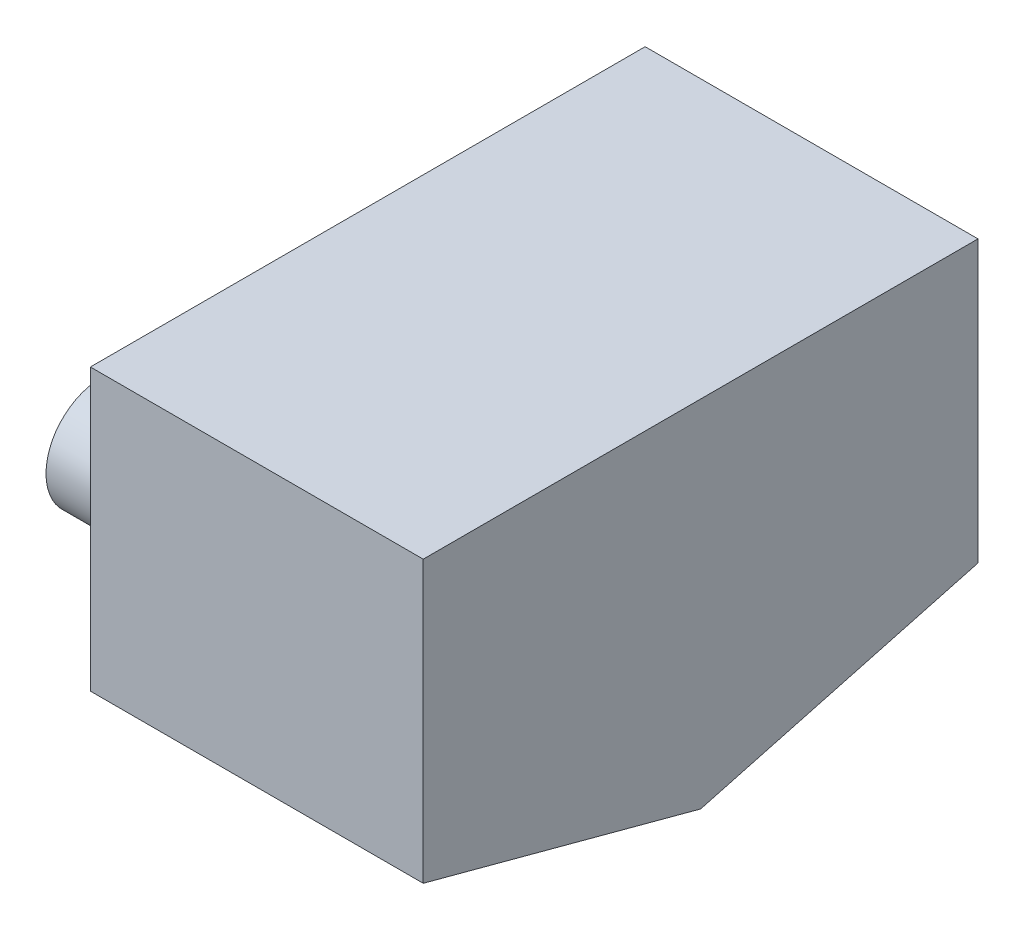
from build123d import *

# Parameters (mm, degrees)
SKETCH2_W           = 15
SKETCH2_H           = 16
BOSS_EXTRUDE2_DEPTH = 25
SKETCH3_R           = 2.5
BOSS_EXTRUDE3_DEPTH = 5
CHAMFER1_SIZE       = 12.5
CHAMFER1_SIZE2      = 3.349364905
CHAMFER2_SIZE       = 12.5
CHAMFER2_SIZE_2     = 3.349364905


with BuildPart() as part:
    # Sketch2 → Boss-Extrude2 (new body)
    with BuildSketch(Plane.XY):
        with Locations((7.5, 8)):
            Rectangle(SKETCH2_W, SKETCH2_H)
    extrude(amount=BOSS_EXTRUDE2_DEPTH)

    # Sketch3 → Boss-Extrude3 (add)
    with BuildSketch(Plane.ZY):
        with Locations(Location((5.5, 7.837863741, 0), (0, 0, 90))):
            Circle(SKETCH3_R)
        with Locations(Location((19.5, 7.837863741, 0), (0, 0, 90))):
            Circle(SKETCH3_R)
    extrude(amount=BOSS_EXTRUDE3_DEPTH)

    # Chamfer1
    chamfer1_edges = [part.edges().sort_by_distance(p)[0] for p in [
        (7.5, 0, 25),
    ]]
    chamfer1_side = [part.faces().sort_by_distance(p)[0] for p in [
        (7.5, 0, 12.5),
    ]]
    chamfer(chamfer1_edges, length=CHAMFER1_SIZE, length2=CHAMFER1_SIZE2, reference=chamfer1_side[0])

    # Chamfer2
    # the kernel refuses this chamfer: 12.5, 3.349364905 mm, written as the material it takes off along each edge
    with BuildSketch(Plane(origin=(-32.459019628, 0, 0), x_dir=(0, -0.009967146577156423, 0.9999503267608394), z_dir=(1, 0, 0))) as chamfer2_piece_1:
        Polygon((CHAMFER2_SIZE * 0.999950326761, -CHAMFER2_SIZE * 0.00996714657716), (-CHAMFER2_SIZE_2 * 0.00996714657831, -CHAMFER2_SIZE_2 * 0.999950326877), (0, 0), align=None)
    extrude(amount=79.918039255, mode=Mode.SUBTRACT)


solid = part.part
